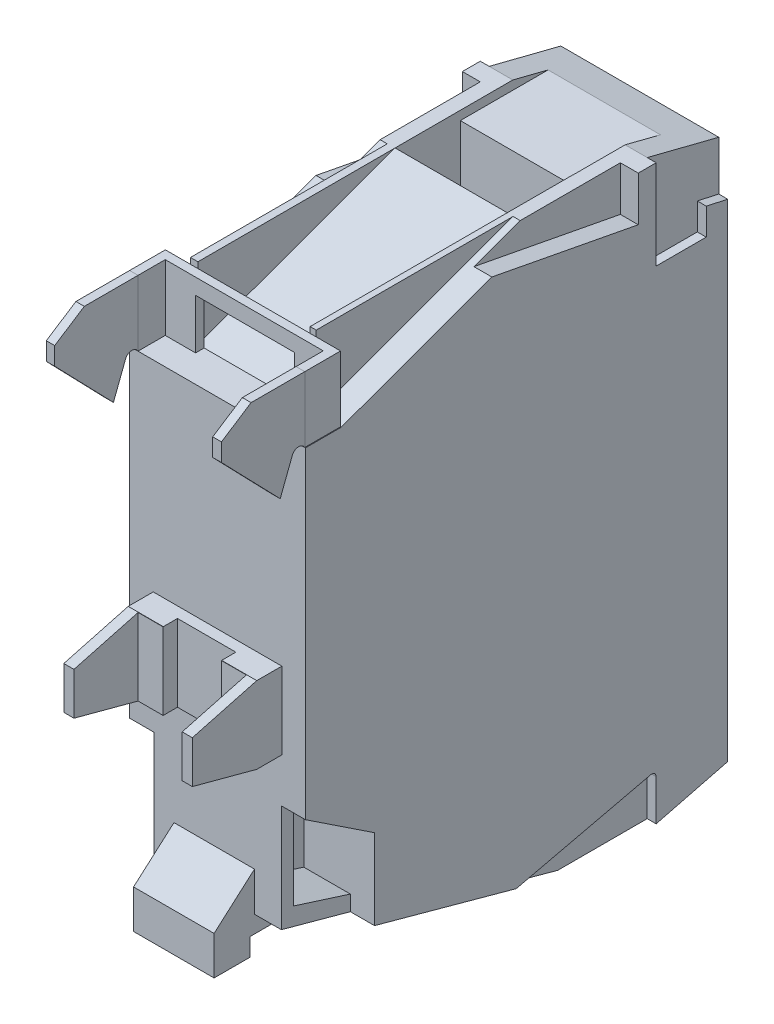
from build123d import *
from OCP.BRepFilletAPI import BRepFilletAPI_MakeChamfer

# Parameters (mm, degrees)
SKETCH1_W                = 9.83
SKETCH1_H                = 32
BOSS_EXTRUDE1_DEPTH      = 23.6
CUT_EXTRUDE1_REACH       = 32.159
CUT_EXTRUDE2_DEPTH       = 0.5
CUT_EXTRUDE3_DEPTH       = 0.5
CUT_EXTRUDE4_REACH       = 32.159
CUT_EXTRUDE5_DEPTH       = 0.5
CUT_EXTRUDE6_DEPTH       = 0.5
CUT_EXTRUDE7_REACH       = 32.159
SKETCH9_W                = 2
SKETCH9_H                = 4
CUT_EXTRUDE8_DEPTH       = 1
CUT_EXTRUDE9_DEPTH       = 1.4
CUT_EXTRUDE10_DEPTH      = 1
CUT_EXTRUDE11_DEPTH      = 1.4
CUT_EXTRUDE12_DEPTH      = 1.35
CUT_EXTRUDE13_DEPTH      = 1.35
CUT_EXTRUDE14_DEPTH      = 2.6
CUT_EXTRUDE15_DEPTH      = 3.6
SKETCH19_W               = 7.182897737
SKETCH19_H               = 2.178759377
CUT_EXTRUDE18_DEPTH      = 1.32
SKETCH21_W               = 8.285586635
SKETCH21_H               = 5.463762064
CUT_EXTRUDE19_DEPTH      = 4.25
BOSS_EXTRUDE2_DEPTH      = 2.25
BOSS_EXTRUDE2_DEPTH_BACK = 2.25
SKETCH23_W               = 6.27247625
SKETCH23_H               = 14.666987047
CUT_EXTRUDE20_DEPTH      = 4
BOSS_EXTRUDE3_REACH      = 33.466
SKETCH25_W               = 6.279577339
SKETCH25_H               = 6.156082968
CUT_EXTRUDE21_DEPTH      = 0.5
SKETCH26_W               = 7.185798512
SKETCH26_H               = 4.295592105
CUT_EXTRUDE22_DEPTH      = 31.802589265
BOSS_EXTRUDE4_DEPTH      = 5
BOSS_EXTRUDE4_DEPTH_BACK = 19.5
SKETCH27_W               = 7.185798512
SKETCH27_H               = 4.295592105
CUT_EXTRUDE23_DEPTH      = 4.295592
CHAMFER3_SIZE            = 3.6
CHAMFER3_SIZE2           = 0.964617093
CHAMFER4_SIZE            = 3.6
CHAMFER4_SIZE2           = 0.964617093
SKETCH29_W               = 3.499012957
SKETCH29_H               = 4.183403899
BOSS_EXTRUDE5_DEPTH      = 0.25
SKETCH30_R               = 2.75
SKETCH30_W               = 8.613757753
SKETCH30_H               = 3.512782784
CUT_EXTRUDE24_DEPTH      = 4
SKETCH31_R               = 2.75
CUT_EXTRUDE25_DEPTH      = 1
SKETCH32_R               = 2.75
BOSS_EXTRUDE6_DEPTH      = 0.75
BOSS_EXTRUDE6_2_DEPTH    = 0.75
SKETCH33_W               = 0.622313759
SKETCH33_H               = 4.486215778
SKETCH33_W_2             = 2.91691535
SKETCH33_H_2             = 0.583263223
SKETCH33_H_3             = 0.583263224
SKETCH33_H_4             = 4.486215777
CUT_EXTRUDE26_DEPTH      = 0.75
SKETCH35_W               = 9.791059678
SKETCH35_H               = 3.669794899
BOSS_EXTRUDE8_DEPTH      = 2
BOSS_EXTRUDE9_DEPTH      = 9.79106
SKETCH38_W               = 8.832235424
SKETCH38_H               = 8.039772077
CUT_EXTRUDE32_DEPTH      = 3.669795
CUT_EXTRUDE33_START      = -1.795116
SKETCH41_W               = 8.832235424
SKETCH41_H               = 2.428139179
CUT_EXTRUDE33_DEPTH      = 1.795116
CUT_EXTRUDE34_START      = -22.077145
SKETCH42_W               = 5.516661754
SKETCH42_H               = 2.788600357
CUT_EXTRUDE34_DEPTH      = 28.6
CUT_EXTRUDE35_DEPTH      = 0.01


with BuildPart() as part:
    # Sketch1 → Boss-Extrude1 (new body)
    with BuildSketch(Plane.XY):
        Rectangle(SKETCH1_W, SKETCH1_H)
    extrude(amount=BOSS_EXTRUDE1_DEPTH)

    # Sketch2 → Cut-Extrude1 (cut, up to next)
    with BuildSketch(Plane(origin=(4.915, 0, 0), x_dir=(0, 0, -1), z_dir=(1, 0, 0)), mode=Mode.PRIVATE) as cut_extrude1_sk1:
        Polygon((-4, 16), (0, 14.985828567), (0, 16), align=None)
    cut_extrude1_tool1 = extrude(cut_extrude1_sk1.sketch, amount=-CUT_EXTRUDE1_REACH, mode=Mode.PRIVATE) & part.part
    # Sketch2 → Cut-Extrude1 (cut, up to next)
    with BuildSketch(Plane(origin=(4.915, 0, 0), x_dir=(0, 0, -1), z_dir=(1, 0, 0)), mode=Mode.PRIVATE) as cut_extrude1_sk2:
        Polygon((0, -16), (0, -14.985828567), (-4, -16), align=None)
    cut_extrude1_tool2 = extrude(cut_extrude1_sk2.sketch, amount=-CUT_EXTRUDE1_REACH, mode=Mode.PRIVATE) & part.part
    add(cut_extrude1_tool1.solids().sort_by_distance((4.915, 15.661943, 1.333333))[0], mode=Mode.SUBTRACT)
    add(cut_extrude1_tool2.solids().sort_by_distance((4.915, -15.661943, 1.333333))[0], mode=Mode.SUBTRACT)

    # Sketch5 → Cut-Extrude2 (cut)
    with BuildSketch(Plane.ZY.offset(4.915)):
        Polygon((4, 16), (4, 11), (1.2, 11), (1.2, 12.5), (0, 12.235925398), (0, 14.985828567), align=None)
    extrude(amount=-CUT_EXTRUDE2_DEPTH, mode=Mode.SUBTRACT)

    # Sketch3 → Cut-Extrude3 (cut)
    with BuildSketch(Plane(origin=(4.915, 0, 0), x_dir=(0, 0, -1), z_dir=(1, 0, 0))):
        Polygon((-4, 16), (-4, 11), (-1.2, 11), (-1.2, 12.5), (0, 12.235925398), (0, 14.985828567), align=None)
    extrude(amount=-CUT_EXTRUDE3_DEPTH, mode=Mode.SUBTRACT)

    # Sketch6 → Cut-Extrude4 (cut, up to next)
    with BuildSketch(Plane(origin=(4.915, 0, 0), x_dir=(0, 0, -1), z_dir=(1, 0, 0)), mode=Mode.PRIVATE) as cut_extrude4_sk1:
        Polygon((-23.6, -12), (-9, -16), (-23.6, -16), align=None)
    cut_extrude4_tool1 = extrude(cut_extrude4_sk1.sketch, amount=-CUT_EXTRUDE4_REACH, mode=Mode.PRIVATE) & part.part
    add(cut_extrude4_tool1.solids().sort_by_distance((4.915, -14.666667, 18.733333))[0], mode=Mode.SUBTRACT)

    # Sketch7 → Cut-Extrude5 (cut)
    with BuildSketch(Plane(origin=(4.915, 0, 0), x_dir=(0, 0, -1), z_dir=(1, 0, 0))):
        with BuildLine():
            Line((-4, -16), (-4, -13.715163243))
            ThreePointArc((-4, -13.715163243), (-4.09463494, -13.519301818), (-4.306893584, -13.471723066))
            Line((-4.306893584, -13.471723066), (-11.819628513, -15.227499038))
            Line((-11.819628513, -15.227499038), (-9, -16))
            Line((-9, -16), (-4, -16))
        make_face()
    extrude(amount=-CUT_EXTRUDE5_DEPTH, mode=Mode.SUBTRACT)

    # Sketch8 → Cut-Extrude6 (cut)
    with BuildSketch(Plane.ZY.offset(4.915)):
        Polygon((4, -16), (4, -13.715163243), (4.09463494, -13.519301818), (4.306893584, -13.471723066), (11.819628513, -15.227499038), (9, -16), align=None)
    extrude(amount=-CUT_EXTRUDE6_DEPTH, mode=Mode.SUBTRACT)

    # Sketch9 → Cut-Extrude7 (cut, up to next)
    with BuildSketch(Plane(origin=(4.915, 0, 0), x_dir=(0, 0, -1), z_dir=(1, 0, 0)), mode=Mode.PRIVATE) as cut_extrude7_sk1:
        with Locations((-22.6, 14)):
            Rectangle(SKETCH9_W, SKETCH9_H)
    cut_extrude7_tool1 = extrude(cut_extrude7_sk1.sketch, amount=-CUT_EXTRUDE7_REACH, mode=Mode.PRIVATE) & part.part
    add(cut_extrude7_tool1.solids().sort_by_distance((4.915, 14, 22.6))[0], mode=Mode.SUBTRACT)

    # Sketch10 → Cut-Extrude8 (cut)
    with BuildSketch(Plane(origin=(4.915, 0, 0), x_dir=(0, 0, -1), z_dir=(1, 0, 0))):
        Polygon((-5, 13.5), (-5, 16), (-18.10239553, 16), align=None)
    extrude(amount=-CUT_EXTRUDE8_DEPTH, mode=Mode.SUBTRACT)

    # Sketch11 → Cut-Extrude9 (cut)
    with BuildSketch(Plane(origin=(4.915, 0, 0), x_dir=(0, 0, -1), z_dir=(1, 0, 0))):
        Polygon((-21.6, 16), (-10.6, 16), (-21.6, 12), align=None)
    extrude(amount=-CUT_EXTRUDE9_DEPTH, mode=Mode.SUBTRACT)

    # Sketch12 → Cut-Extrude10 (cut)
    with BuildSketch(Plane.ZY.offset(4.915)):
        Polygon((5, 16), (5, 13.5), (18.10239553, 16), align=None)
    extrude(amount=-CUT_EXTRUDE10_DEPTH, mode=Mode.SUBTRACT)

    # Sketch13 → Cut-Extrude11 (cut)
    with BuildSketch(Plane.ZY.offset(4.915)):
        Polygon((21.6, 12), (21.6, 16), (10.6, 16), align=None)
    extrude(amount=-CUT_EXTRUDE11_DEPTH, mode=Mode.SUBTRACT)

    # Sketch14 → Cut-Extrude12 (cut)
    with BuildSketch(Plane(origin=(4.915, 0, 0), x_dir=(0, 0, -1), z_dir=(1, 0, 0))):
        Polygon((-23.6, -12), (-23.6, -6), (-19.742166853, -8.556940588), (-19.742166853, -13.056940588), align=None)
    extrude(amount=-CUT_EXTRUDE12_DEPTH, mode=Mode.SUBTRACT)

    # Sketch15 → Cut-Extrude13 (cut)
    with BuildSketch(Plane.ZY.offset(4.915)):
        Polygon((19.742166853, -13.056940588), (19.742166853, -8.556940588), (23.6, -6), (23.6, -12), align=None)
    extrude(amount=-CUT_EXTRUDE13_DEPTH, mode=Mode.SUBTRACT)

    # Sketch16 → Cut-Extrude14 (cut)
    with BuildSketch(Plane(origin=(3.565, 0, 0), x_dir=(0, 0, -1), z_dir=(1, 0, 0))):
        Polygon((-22.922592203, -6.448980406), (-22.922592203, -11.190433252), (-19.742166853, -12.201066505), (-19.742166853, -8.556940588), align=None)
    extrude(amount=-CUT_EXTRUDE14_DEPTH, mode=Mode.SUBTRACT)

    # Sketch18 → Cut-Extrude15 (cut)
    with BuildSketch(Plane.ZY.offset(3.565)):
        Polygon((19.742166853, -12.201066505), (19.742166853, -8.556940588), (22.922592203, -6.448980406), (22.922592203, -11.190433252), align=None)
    extrude(amount=-CUT_EXTRUDE15_DEPTH, mode=Mode.SUBTRACT)

    # Sketch19 → Cut-Extrude18 (cut)
    with BuildSketch(Plane(origin=(0, -14.080667223, -3.570052614), x_dir=(1, 0, 0), z_dir=(0, -0.9693290698641888, -0.2457664629607274))):
        with Locations((0.133177719, 6.014201082)):
            Rectangle(SKETCH19_W, SKETCH19_H)
    extrude(amount=-CUT_EXTRUDE18_DEPTH, mode=Mode.SUBTRACT)

    # Chamfer2
    # the kernel refuses this chamfer: 2.799038106, 0.75 mm, written as the material it takes off along each edge
    with BuildSketch(Plane(origin=(-3.45827115, -15.826489143, 3.315654727), x_dir=(-0.9905000388259536, -0.13329481236589955, -0.033795947717498075), z_dir=(0, 0.24576646296072743, -0.9693290698641889))) as chamfer2_piece_1_section:
        with BuildLine():
            Line((0.78644901, 0), (-0.42847656, 2.875581688))
            Line((-0.42847656, 2.875581688), (-0.483925507, 2.867883636))
            ThreePointArc((-0.483925507, 2.867883636), (-0.255335983, 1.432085195), (-0.055448947, -0.007698052))
            Line((-0.055448947, -0.007698052), (0.007698052, -0.055448947))
            ThreePointArc((0.007698052, -0.055448947), (0.39348681, -0.001889377), (0.794147061, -0.055448947))
            Line((0.794147061, -0.055448947), (0.78644901, 0))
        make_face()
    chamfer2_piece_1 = extrude(amount=2.178759377, mode=Mode.PRIVATE)
    chamfer2_piece_1 = split(chamfer2_piece_1, bisect_by=Plane(origin=(-3.7390551, -14.279241778, 2.584099058), z_dir=(0, -0.9693290698641888, -0.2457664629607274)), keep=Keep.TOP, mode=Mode.PRIVATE)
    add(chamfer2_piece_1, mode=Mode.SUBTRACT)
    with BuildSketch(Plane(origin=(-3.45827115, -15.291023158, 1.203719926), x_dir=(0, 0.11013687873881672, -0.9939164290531027), z_dir=(1, 0, 0))) as chamfer2_piece_2_section:
        with BuildLine():
            Line((0.78644901, 0), (-0.42847656, 2.875581688))
            Line((-0.42847656, 2.875581688), (-0.483925507, 2.867883636))
            ThreePointArc((-0.483925507, 2.867883636), (-0.255335983, 1.432085195), (-0.055448947, -0.007698052))
            Line((-0.055448947, -0.007698052), (0.007698052, -0.055448947))
            ThreePointArc((0.007698052, -0.055448947), (0.39348681, -0.001889377), (0.794147061, -0.055448947))
            Line((0.794147061, -0.055448947), (0.78644901, 0))
        make_face()
    chamfer2_piece_2 = extrude(amount=7.182897736, mode=Mode.PRIVATE)
    chamfer2_piece_2 = split(chamfer2_piece_2, bisect_by=Plane(origin=(0.133177718, -13.942501507, 1.255959612), z_dir=(0, -0.9693290698641888, -0.2457664629607274)), keep=Keep.TOP, mode=Mode.PRIVATE)
    add(chamfer2_piece_2, mode=Mode.SUBTRACT)
    with BuildSketch(Plane(origin=(3.724626587, -15.291023158, 1.203719926), x_dir=(0.9905000388259536, -0.1332948123658999, -0.03379594771749775), z_dir=(0, -0.24576646296072743, 0.9693290698641889))) as chamfer2_piece_3_section:
        with BuildLine():
            Line((0.78644901, 0), (-0.42847656, 2.875581688))
            Line((-0.42847656, 2.875581688), (-0.483925507, 2.867883636))
            ThreePointArc((-0.483925507, 2.867883636), (-0.255335983, 1.432085195), (-0.055448947, -0.007698052))
            Line((-0.055448947, -0.007698052), (0.007698052, -0.055448947))
            ThreePointArc((0.007698052, -0.055448947), (0.39348681, -0.001889377), (0.794147061, -0.055448947))
            Line((0.794147061, -0.055448947), (0.78644901, 0))
        make_face()
    chamfer2_piece_3 = extrude(amount=2.178759377, mode=Mode.PRIVATE)
    chamfer2_piece_3 = split(chamfer2_piece_3, bisect_by=Plane(origin=(4.005410537, -14.279241778, 2.584099058), z_dir=(0, -0.9693290698641888, -0.2457664629607274)), keep=Keep.TOP, mode=Mode.PRIVATE)
    add(chamfer2_piece_3, mode=Mode.SUBTRACT)
    with BuildSketch(Plane(origin=(-10.726593775, -15.291023158, 1.203719926), x_dir=(0, 0.11013687873882122, -0.9939164290531021), z_dir=(1, 0, 0))) as chamfer2_piece_4a_section:
        with BuildLine():
            Line((0.78644901, 0), (-0.42847656, 2.875581688))
            Line((-0.42847656, 2.875581688), (-0.483925507, 2.867883636))
            ThreePointArc((-0.483925507, 2.867883636), (-0.255335983, 1.432085195), (-0.055448947, -0.007698052))
            Line((-0.055448947, -0.007698052), (0.007698052, -0.055448947))
            ThreePointArc((0.007698052, -0.055448947), (0.39348681, -0.001889377), (0.794147061, -0.055448947))
            Line((0.794147061, -0.055448947), (0.78644901, 0))
        make_face()
    chamfer2_piece_4a = extrude(amount=14.451220361, mode=Mode.PRIVATE)
    chamfer2_piece_4a = split(chamfer2_piece_4a, bisect_by=Plane(origin=(-3.45827115, -14.683152158, 1.068172929), z_dir=(-1, 0, 0)), keep=Keep.TOP, mode=Mode.PRIVATE)
    chamfer2_piece_4a = split(chamfer2_piece_4a, bisect_by=Plane(origin=(-7.092432462, -13.942501507, 1.255959612), z_dir=(0, -0.9693290698641888, -0.2457664629607274)), keep=Keep.TOP, mode=Mode.PRIVATE)
    with BuildSketch(Plane(origin=(-3.45827115, -15.826489143, 3.315654727), x_dir=(-0.9905000388259536, -0.13329481236589955, -0.033795947717498075), z_dir=(0, 0.24576646296072743, -0.9693290698641889))) as chamfer2_piece_4b_section:
        with BuildLine():
            Line((0.78644901, 0), (-0.42847656, 2.875581688))
            Line((-0.42847656, 2.875581688), (-0.483925507, 2.867883636))
            ThreePointArc((-0.483925507, 2.867883636), (-0.255335983, 1.432085195), (-0.055448947, -0.007698052))
            Line((-0.055448947, -0.007698052), (0.007698052, -0.055448947))
            ThreePointArc((0.007698052, -0.055448947), (0.39348681, -0.001889377), (0.794147061, -0.055448947))
            Line((0.794147061, -0.055448947), (0.78644901, 0))
        make_face()
    chamfer2_piece_4b = extrude(amount=9.447082002, mode=Mode.PRIVATE)
    chamfer2_piece_4b = split(chamfer2_piece_4b, bisect_by=Plane(origin=(-3.7390551, -14.752159437, 1.340344974), z_dir=(0, 0.24576646296072743, -0.9693290698641889)), keep=Keep.TOP, mode=Mode.PRIVATE)
    chamfer2_piece_4b = split(chamfer2_piece_4b, bisect_by=Plane(origin=(-3.7390551, -13.118353814, -1.994566548), z_dir=(0, -0.9693290698641888, -0.2457664629607274)), keep=Keep.TOP, mode=Mode.PRIVATE)
    chamfer2_piece_4 = chamfer2_piece_4a & chamfer2_piece_4b
    add(chamfer2_piece_4, mode=Mode.SUBTRACT)
    with BuildSketch(Plane(origin=(3.724626587, -13.504713214, -5.841676483), x_dir=(0.9905000388259537, -0.13329481236589816, -0.0337959477174973), z_dir=(0, -0.24576646296072743, 0.9693290698641889))) as chamfer2_piece_5a_section:
        with BuildLine():
            Line((0.78644901, 0), (-0.42847656, 2.875581688))
            Line((-0.42847656, 2.875581688), (-0.483925507, 2.867883636))
            ThreePointArc((-0.483925507, 2.867883636), (-0.255335983, 1.432085195), (-0.055448947, -0.007698052))
            Line((-0.055448947, -0.007698052), (0.007698052, -0.055448947))
            ThreePointArc((0.007698052, -0.055448947), (0.39348681, -0.001889377), (0.794147061, -0.055448947))
            Line((0.794147061, -0.055448947), (0.78644901, 0))
        make_face()
    chamfer2_piece_5a = extrude(amount=9.447082002, mode=Mode.PRIVATE)
    chamfer2_piece_5a = split(chamfer2_piece_5a, bisect_by=Plane(origin=(4.005410537, -14.752159437, 1.340344974), z_dir=(0, 0.24576646296072743, -0.9693290698641889)), keep=Keep.TOP, mode=Mode.PRIVATE)
    chamfer2_piece_5a = split(chamfer2_piece_5a, bisect_by=Plane(origin=(4.005410537, -13.118353814, -1.994566548), z_dir=(0, -0.9693290698641888, -0.2457664629607274)), keep=Keep.TOP, mode=Mode.PRIVATE)
    with BuildSketch(Plane(origin=(-3.45827115, -15.291023158, 1.203719926), x_dir=(0, 0.11013687873881672, -0.9939164290531027), z_dir=(1, 0, 0))) as chamfer2_piece_5b_section:
        with BuildLine():
            Line((0.78644901, 0), (-0.42847656, 2.875581688))
            Line((-0.42847656, 2.875581688), (-0.483925507, 2.867883636))
            ThreePointArc((-0.483925507, 2.867883636), (-0.255335983, 1.432085195), (-0.055448947, -0.007698052))
            Line((-0.055448947, -0.007698052), (0.007698052, -0.055448947))
            ThreePointArc((0.007698052, -0.055448947), (0.39348681, -0.001889377), (0.794147061, -0.055448947))
            Line((0.794147061, -0.055448947), (0.78644901, 0))
        make_face()
    chamfer2_piece_5b = extrude(amount=14.451220361, mode=Mode.PRIVATE)
    chamfer2_piece_5b = split(chamfer2_piece_5b, bisect_by=Plane(origin=(3.724626587, -14.683152158, 1.068172929), z_dir=(1, 0, 0)), keep=Keep.TOP, mode=Mode.PRIVATE)
    chamfer2_piece_5b = split(chamfer2_piece_5b, bisect_by=Plane(origin=(7.358787899, -13.942501507, 1.255959612), z_dir=(0, -0.9693290698641888, -0.2457664629607274)), keep=Keep.TOP, mode=Mode.PRIVATE)
    chamfer2_piece_5 = chamfer2_piece_5a & chamfer2_piece_5b
    add(chamfer2_piece_5, mode=Mode.SUBTRACT)

    # Sketch21 → Cut-Extrude19 (cut)
    with BuildSketch(Plane(origin=(0, -14.080667223, -3.570052614), x_dir=(-1, 0, 0), z_dir=(0, -0.9693290698641888, -0.2457664629607274))):
        with Locations((0.065477832, -9.835461802)):
            Rectangle(SKETCH21_W, SKETCH21_H)
    extrude(amount=-CUT_EXTRUDE19_DEPTH, mode=Mode.SUBTRACT)

    # Sketch22 → Boss-Extrude2 (add, two sides: drawn at the far end of the back side and taken through both)
    with BuildSketch(Plane(origin=(-0.185, 0, 0), x_dir=(0, 0, -1), z_dir=(1, 0, 0)).offset(-BOSS_EXTRUDE2_DEPTH_BACK)):
        Polygon((-19.858118269, -12.957237014), (-23.858118269, -12.957237014), (-23.858118269, -13.957237014), (-25.858118269, -13.957237014), (-25.858118269, -11.798752032), (-23.592707946, -9.808092274), (-23.473074349, -11.374374647), align=None)
    extrude(amount=BOSS_EXTRUDE2_DEPTH + BOSS_EXTRUDE2_DEPTH_BACK)

    # Sketch23 → Cut-Extrude20 (cut)
    with BuildSketch(Plane(origin=(0, 16, 0), x_dir=(1, 0, 0), z_dir=(0, 1, 0))):
        with Locations((0.038081978, -14.266506477)):
            Rectangle(SKETCH23_W, SKETCH23_H)
    extrude(amount=-CUT_EXTRUDE20_DEPTH, mode=Mode.SUBTRACT)

    # Sketch24 → Boss-Extrude3 (add, up to next)
    with BuildSketch(Plane.ZY.offset(-3.174320103), mode=Mode.PRIVATE) as boss_extrude3_sk1:
        Polygon((10.579716493, 16), (21.6, 12), (10.579716493, 12), align=None)
    boss_extrude3_tool1 = extrude(boss_extrude3_sk1.sketch, amount=BOSS_EXTRUDE3_REACH, mode=Mode.PRIVATE) - part.part
    add(boss_extrude3_tool1.solids().sort_by_distance((3.17432, 13.333333, 14.253144))[0])

    # Sketch25 → Cut-Extrude21 (cut)
    with BuildSketch(Plane(origin=(0, 16, 0), x_dir=(1, 0, 0), z_dir=(0, 1, 0))):
        with Locations((0.041632523, -3.854971469)):
            Rectangle(SKETCH25_W, SKETCH25_H)
    extrude(amount=-CUT_EXTRUDE21_DEPTH, mode=Mode.SUBTRACT)

    # Sketch26 → Cut-Extrude22 (cut, through all)
    with BuildSketch(Plane(origin=(0, 0, 0), x_dir=(-1, 0, 0), z_dir=(0, 0, -1))):
        with Locations((0, -1.374951584)):
            Rectangle(SKETCH26_W, SKETCH26_H)
    extrude(amount=-CUT_EXTRUDE22_DEPTH, mode=Mode.SUBTRACT)



with BuildPart() as body_2:
    # Sketch27 → Boss-Extrude4 (new, two sides: drawn at the far end of the back side and taken through both)
    with BuildSketch(Plane.XY.offset(23.6).offset(-BOSS_EXTRUDE4_DEPTH_BACK)):
        with Locations((0, -1.374951584)):
            Rectangle(SKETCH27_W, SKETCH27_H)
    extrude(amount=BOSS_EXTRUDE4_DEPTH + BOSS_EXTRUDE4_DEPTH_BACK)

    # Sketch28 → Cut-Extrude23 (cut)
    with BuildSketch(Plane(origin=(0, 0.772844468, 0), x_dir=(1, 0, 0), z_dir=(0, 1, 0))):
        Polygon((-3.024869573, -28.6), (0, -28.6), (0, -24.208534676), (-1.631367449, -24.208534676), (-1.631367449, -25.013795774), (-3.024869573, -25.013795774), align=None)
        Polygon((0, -28.6), (3.024869573, -28.6), (3.024869573, -25.013795774), (1.631367449, -25.013795774), (1.631367449, -24.208534676), (0, -24.208534676), align=None)
    extrude(amount=-CUT_EXTRUDE23_DEPTH, mode=Mode.SUBTRACT)

    # Chamfer3: one chamfer whose edges measure the first distance from different faces: ONE call of the kernel's chamfer builder (chamfer() names one face for all edges)
    chamfer3_edges_1 = [body_2.edges().sort_by_distance(p)[0] for p in [
        (3.308884414, 0.772844468, 28.6),
    ]]
    chamfer3_side_1 = [body_2.faces().sort_by_distance(p)[0] for p in [
        (0, 0.772844468, 14.711727186),
    ]]
    chamfer3_edges_2 = [body_2.edges().sort_by_distance(p)[0] for p in [
        (3.308884414, -3.522747637, 28.6),
    ]]
    chamfer3_side_2 = [body_2.faces().sort_by_distance(p)[0] for p in [
        (0, -3.522747637, 14.711727186),
    ]]
    chamfer3 = BRepFilletAPI_MakeChamfer(body_2.part.solid().wrapped)
    for e in chamfer3_edges_1:
        chamfer3.Add(CHAMFER3_SIZE, CHAMFER3_SIZE2, e.wrapped, chamfer3_side_1[0].wrapped)  # the first distance lies on this face
    for e in chamfer3_edges_2:
        chamfer3.Add(CHAMFER3_SIZE, CHAMFER3_SIZE2, e.wrapped, chamfer3_side_2[0].wrapped)  # the first distance lies on this face
    add(Compound.cast(chamfer3.Shape()), mode=Mode.REPLACE)

    # Chamfer4: one chamfer whose edges measure the first distance from different faces: ONE call of the kernel's chamfer builder (chamfer() names one face for all edges)
    chamfer4_edges_1 = [body_2.edges().sort_by_distance(p)[0] for p in [
        (-3.308884414, 0.772844468, 28.6),
    ]]
    chamfer4_side_1 = [body_2.faces().sort_by_distance(p)[0] for p in [
        (-0.045509092, 0.772844468, 14.545239935),
    ]]
    chamfer4_edges_2 = [body_2.edges().sort_by_distance(p)[0] for p in [
        (-3.308884414, -3.522747637, 28.6),
    ]]
    chamfer4_side_2 = [body_2.faces().sort_by_distance(p)[0] for p in [
        (-0.045509092, -3.522747637, 14.545239935),
    ]]
    chamfer4 = BRepFilletAPI_MakeChamfer(body_2.part.solid().wrapped)
    for e in chamfer4_edges_1:
        chamfer4.Add(CHAMFER4_SIZE, CHAMFER4_SIZE2, e.wrapped, chamfer4_side_1[0].wrapped)  # the first distance lies on this face
    for e in chamfer4_edges_2:
        chamfer4.Add(CHAMFER4_SIZE, CHAMFER4_SIZE2, e.wrapped, chamfer4_side_2[0].wrapped)  # the first distance lies on this face
    add(Compound.cast(chamfer4.Shape()), mode=Mode.REPLACE)


with BuildPart() as part_1:
    add(part.part)

    add(body_2.part)  # Boss-Extrude5 merges body 2
    # Sketch29 → Boss-Extrude5 (add)
    with BuildSketch(Plane(origin=(0, 0, 4.1), x_dir=(-1, 0, 0), z_dir=(0, 0, -1))):
        with Locations((-0.007925079, -1.431045688)):
            Rectangle(SKETCH29_W, SKETCH29_H)
    extrude(amount=BOSS_EXTRUDE5_DEPTH)

    # Sketch30 → Cut-Extrude24 (cut)
    with BuildSketch(Plane(origin=(0, 0, 0), x_dir=(-1, 0, 0), z_dir=(0, 0, -1))):
        with Locations((0, 9.681432772)):
            Circle(SKETCH30_R)
        with Locations((0, -10.236294495)):
            Circle(SKETCH30_R)
        with Locations((-0.080372339, 9.625466097)):
            Rectangle(SKETCH30_W, SKETCH30_H)
    extrude(amount=-CUT_EXTRUDE24_DEPTH, mode=Mode.SUBTRACT)

    # Sketch31 → Cut-Extrude25 (cut)
    with BuildSketch(Plane(origin=(0, 0, 4), x_dir=(-1, 0, 0), z_dir=(0, 0, -1))):
        with Locations((0, 9.681432772)):
            Circle(SKETCH31_R)
        with Locations((0, -10.236294495)):
            Circle(SKETCH31_R)
    extrude(amount=-CUT_EXTRUDE25_DEPTH, mode=Mode.SUBTRACT)

    # Sketch43 → Cut-Extrude35 (cut)
    with BuildSketch(Plane(origin=(0, 0, 0), x_dir=(-1, 0, 0), z_dir=(0, 0, -1))):
        Polygon((-0.670793992, 1.057778526), (-0.670793992, 3.153774619), (-0.63678444, 3.153774619), (0.377204055, 1.59059484), (0.377204055, 3.153774619), (0.538434524, 3.153774619), (0.538434524, 1.057778526), (0.501905746, 1.057778526), (-0.509563523, 2.617179466), (-0.509563523, 1.057778526), align=None)
        with BuildLine():
            Line((2.207169876, 2.769172772), (2.085407282, 2.643211468))
            add(Edge.make_bspline(
                [(2.085407282, 2.643211468), (2.068745196, 2.670451516), (2.036380064, 2.723363724), (1.979938123, 2.794599751), (1.917669166, 2.85465587), (1.851067126, 2.904671417), (1.780261302, 2.944198517), (1.705368563, 2.972055623), (1.627158711, 2.989588583), (1.573675889, 2.991553531), (1.546712773, 2.992544151)],
                knots=[0, 0, 0, 0, 1.135693638, 2.206018759, 3.223992528, 4.206184903, 5.162592443, 6.098801558, 7.041519676, 8, 8, 8, 8], degree=3))
            add(Edge.make_bspline(
                [(1.546712773, 2.992544151), (1.531855172, 2.992295616), (1.50216045, 2.991798888), (1.458246659, 2.985491277), (1.415074397, 2.976418037), (1.372822275, 2.963204669), (1.331434066, 2.946431794), (1.290608984, 2.926117617), (1.251012698, 2.901740946), (1.212273186, 2.873972286), (1.175188019, 2.843003124), (1.139787623, 2.809514454), (1.10704704, 2.773000244), (1.075823198, 2.73458757), (1.047334211, 2.693158293), (1.020682533, 2.649357421), (0.996593668, 2.602793502), (0.974197762, 2.554128674), (0.954617245, 2.503313261), (0.937290653, 2.45096023), (0.923166021, 2.396744851), (0.910862878, 2.341206434), (0.901609987, 2.28400788), (0.895598879, 2.225252641), (0.891017563, 2.165049839), (0.890643257, 2.124259993), (0.890454381, 2.103677217)],
                knots=[0, 0, 0, 0, 0.872413377, 1.743624148, 2.601810317, 3.462868589, 4.341039258, 5.223781062, 6.13921199, 7.070430216, 8.022373848, 8.976411344, 9.931299268, 10.902343116, 11.883366553, 12.883408275, 13.913437901, 14.962338874, 16.029936028, 17.111882572, 18.201119231, 19.320673536, 20.453740451, 21.603577775, 22.790752465, 24, 24, 24, 24], degree=3))
            add(Edge.make_bspline(
                [(0.890454381, 2.103677217), (0.890987462, 2.072723444), (0.892031762, 2.012085399), (0.901145807, 1.923142401), (0.915441786, 1.838110374), (0.936853801, 1.757118428), (0.963009991, 1.679728492), (0.995468093, 1.606152223), (1.034257823, 1.536903048), (1.078030621, 1.471985285), (1.126446811, 1.412998933), (1.178364621, 1.361009544), (1.233919324, 1.317424796), (1.292085852, 1.281344777), (1.353564151, 1.253226597), (1.418279459, 1.233738496), (1.486018972, 1.220829678), (1.532376474, 1.21962274), (1.555949935, 1.219008994)],
                knots=[0, 0, 0, 0, 1.2059327, 2.362406674, 3.480524526, 4.562612735, 5.623337043, 6.661098003, 7.691437249, 8.712510888, 9.708320492, 10.66089415, 11.569762527, 12.453727026, 13.322622265, 14.195564816, 15.082418534, 16, 16, 16, 16], degree=3))
            add(Edge.make_bspline(
                [(1.555949935, 1.219008994), (1.581931784, 1.220025128), (1.633305601, 1.222034325), (1.708473241, 1.239110104), (1.780224445, 1.266591684), (1.848475301, 1.305528221), (1.913497993, 1.355131034), (1.974933532, 1.415876863), (2.033238803, 1.48733389), (2.06759491, 1.54068243), (2.085407282, 1.568341677)],
                knots=[0, 0, 0, 0, 0.93689583, 1.852520847, 2.767253495, 3.701530616, 4.678576124, 5.71099564, 6.813235843, 8, 8, 8, 8], degree=3))
            Line((2.085407282, 1.568341677), (2.207169876, 1.443639986))
            add(Edge.make_bspline(
                [(2.207169876, 1.443639986), (2.197696866, 1.426597517), (2.178923552, 1.392823285), (2.147936798, 1.34472536), (2.115009813, 1.299800165), (2.08092637, 1.257270558), (2.044556138, 1.218166778), (2.006594816, 1.181815753), (1.96701362, 1.148424652), (1.925550874, 1.118372617), (1.882768236, 1.091313536), (1.838443479, 1.068219797), (1.792990652, 1.04842387), (1.746322976, 1.031930598), (1.698295187, 1.019276066), (1.648983661, 1.010646412), (1.598494971, 1.004856345), (1.564363701, 1.004310569), (1.547132644, 1.004035036)],
                knots=[0, 0, 0, 0, 1.120033088, 2.219646473, 3.284367226, 4.319154029, 5.349055599, 6.350017175, 7.337353397, 8.321672642, 9.289931778, 10.243047789, 11.190141157, 12.136175768, 13.084053903, 14.039879559, 15.01043975, 16, 16, 16, 16], degree=3))
            add(Edge.make_bspline(
                [(1.547132644, 1.004035036), (1.530884098, 1.004197108), (1.498598351, 1.004519145), (1.450964468, 1.009524173), (1.40449098, 1.01641047), (1.359556322, 1.02673027), (1.31560174, 1.039029029), (1.273299465, 1.055318687), (1.23200714, 1.073545091), (1.192310123, 1.095308041), (1.153676691, 1.119600168), (1.116255678, 1.146838716), (1.080623431, 1.177313275), (1.045993106, 1.210107898), (1.012810419, 1.24591339), (0.980903643, 1.284640419), (0.950129513, 1.3262222), (0.931161472, 1.355637902), (0.921524836, 1.37058243)],
                knots=[0, 0, 0, 0, 1.025194621, 2.037054553, 3.020434316, 3.989260086, 4.945557148, 5.898952184, 6.848039227, 7.792881249, 8.753738336, 9.727426248, 10.711599443, 11.711470044, 12.736702733, 13.790987993, 14.877720364, 16, 16, 16, 16], degree=3))
            add(Edge.make_bspline(
                [(0.921524836, 1.37058243), (0.906100705, 1.396795099), (0.875076868, 1.449518821), (0.836471919, 1.533478072), (0.802877986, 1.621017214), (0.776483761, 1.712881039), (0.75450225, 1.808359466), (0.740533735, 1.90812079), (0.730658647, 2.011667041), (0.729707898, 2.082098913), (0.729223912, 2.117952832)],
                knots=[0, 0, 0, 0, 0.93320784, 1.87703854, 2.833065133, 3.809300283, 4.808988226, 5.838375245, 6.899607296, 8, 8, 8, 8], degree=3))
            add(Edge.make_bspline(
                [(0.729223912, 2.117952832), (0.729947522, 2.155629741), (0.731368277, 2.229605587), (0.742602979, 2.338192098), (0.760289816, 2.442298468), (0.786232504, 2.541554646), (0.818276326, 2.636779185), (0.858843369, 2.726893652), (0.90603429, 2.812876702), (0.960241473, 2.893177946), (1.019569015, 2.966757135), (1.083560741, 3.031195825), (1.151723778, 3.085202675), (1.222921688, 3.130383518), (1.298319026, 3.165154105), (1.377556474, 3.189452691), (1.460339568, 3.20463653), (1.516836802, 3.206549282), (1.54545316, 3.207518109)],
                knots=[0, 0, 0, 0, 1.195271502, 2.34682787, 3.460228925, 4.542725944, 5.598821008, 6.644472296, 7.67408218, 8.707477688, 9.714544999, 10.669163693, 11.582576715, 12.468500816, 13.338827293, 14.208303603, 15.092489635, 16, 16, 16, 16], degree=3))
            add(Edge.make_bspline(
                [(1.54545316, 3.207518109), (1.562821163, 3.20722329), (1.597364843, 3.206636915), (1.648476977, 3.201090447), (1.698378378, 3.191691734), (1.746944041, 3.179170592), (1.794421192, 3.163308208), (1.840124358, 3.142876869), (1.884744605, 3.119339718), (1.928039628, 3.092507909), (1.969538565, 3.062124212), (2.009537767, 3.029067062), (2.047201982, 2.992677135), (2.083689636, 2.954106392), (2.117432397, 2.912022163), (2.149598518, 2.867218264), (2.179771326, 2.819558068), (2.197978979, 2.786074617), (2.207169876, 2.769172772)],
                knots=[0, 0, 0, 0, 0.996050703, 1.981071612, 2.944758098, 3.906703988, 4.856240635, 5.812440303, 6.774922097, 7.748490416, 8.731283955, 9.723249409, 10.722659482, 11.73373946, 12.766922331, 13.814078862, 14.896586223, 16, 16, 16, 16], degree=3))
        make_face()
        Polygon((3.269498979, 4.282743905), (3.85654325, 4.282743905), (3.85654325, 1.107743905), (3.571607352, 1.107743905), (3.571607352, 3.95710288), (3.083145814, 3.95710288), align=None)
        with BuildLine():
            Line((2.813292198, -5.429753852), (2.528356301, -5.429753852))
            add(Edge.make_bspline(
                [(2.528356301, -5.429753852), (2.530213361, -5.391952404), (2.533860578, -5.317711365), (2.550940526, -5.209467536), (2.57537975, -5.10600354), (2.60993414, -5.008150118), (2.652847692, -4.915042057), (2.704309932, -4.827049186), (2.765264353, -4.744507179), (2.834394748, -4.668181228), (2.909477727, -4.598161075), (2.990490972, -4.537695247), (3.075621819, -4.486607074), (3.164611988, -4.443897662), (3.258465499, -4.411839373), (3.356330663, -4.3880526), (3.458637451, -4.373741201), (3.528342328, -4.372202881), (3.563792999, -4.371420519)],
                knots=[0, 0, 0, 0, 1.10065271, 2.161652631, 3.183658789, 4.190468796, 5.17591951, 6.163126047, 7.15150782, 8.156236427, 9.156009102, 10.134482811, 11.092018607, 12.041330605, 13.001268258, 13.972401359, 14.968799086, 16, 16, 16, 16], degree=3))
            add(Edge.make_bspline(
                [(3.563792999, -4.371420519), (3.598607395, -4.372235547), (3.667016439, -4.373837048), (3.766858409, -4.387590268), (3.861906384, -4.409130912), (3.951974572, -4.439352754), (4.036344359, -4.479978627), (4.115649549, -4.52878068), (4.190834285, -4.585222956), (4.258513296, -4.651674629), (4.32065991, -4.722615364), (4.374274099, -4.798350819), (4.420187469, -4.8765731), (4.458457721, -4.957878683), (4.486630076, -5.043033116), (4.508018879, -5.130796649), (4.520108747, -5.222077728), (4.521964238, -5.283860104), (4.522907583, -5.315270679)],
                knots=[0, 0, 0, 0, 1.111607364, 2.184268762, 3.212621178, 4.221274766, 5.211760367, 6.196651075, 7.1921475, 8.207485113, 9.220403448, 10.201281604, 11.166441695, 12.114753415, 13.065576456, 14.026450734, 14.996634279, 16, 16, 16, 16], degree=3))
            add(Edge.make_bspline(
                [(4.522907583, -5.315270679), (4.521371551, -5.359491929), (4.518326444, -5.447158408), (4.492278402, -5.575986177), (4.45159621, -5.700803064), (4.402612893, -5.801257617), (4.353198605, -5.882205143), (4.308669223, -5.948851754), (4.25654043, -6.020611715), (4.196053507, -6.097244728), (4.128459687, -6.179351049), (4.053146725, -6.266881077), (3.969577566, -6.358930469), (3.910923069, -6.42180055), (3.880529778, -6.454378251)],
                knots=[0, 0, 0, 0, 1.184426356, 2.348067706, 3.509069118, 4.696110526, 5.333549288, 6.050745305, 6.844228056, 7.710549037, 8.667450064, 9.695053472, 10.805634456, 12, 12, 12, 12], degree=3))
            Line((3.880529778, -6.454378251), (3.08614376, -7.302189749))
            Line((3.08614376, -7.302189749), (4.563612711, -7.302189749))
            Line((4.563612711, -7.302189749), (4.563612711, -7.627830775))
            Line((4.563612711, -7.627830775), (2.406240916, -7.627830775))
            Line((2.406240916, -7.627830775), (3.637571044, -6.313818355))
            add(Edge.make_bspline(
                [(3.637571044, -6.313818355), (3.667550199, -6.282523463), (3.725134019, -6.222412379), (3.806579642, -6.134652694), (3.879730724, -6.053237039), (3.945060788, -5.978319242), (4.001152611, -5.908803462), (4.050929564, -5.846941124), (4.090812636, -5.790013873), (4.134097316, -5.724027744), (4.176019999, -5.643462285), (4.212044779, -5.545006724), (4.234011106, -5.443654145), (4.236646207, -5.375163011), (4.237971685, -5.340711384)],
                knots=[0, 0, 0, 0, 1.329631726, 2.553950428, 3.673215718, 4.687767853, 5.603093632, 6.413772471, 7.123043292, 7.734684054, 8.834405432, 9.900288307, 10.943827018, 12, 12, 12, 12], degree=3))
            add(Edge.make_bspline(
                [(4.237971685, -5.340711384), (4.237394976, -5.319047544), (4.236258393, -5.276352275), (4.226227482, -5.213754194), (4.211068666, -5.153370399), (4.189346896, -5.095015151), (4.160675067, -5.039275167), (4.125774216, -4.986082596), (4.085506087, -4.934657606), (4.038923149, -4.886439971), (3.987749842, -4.842279163), (3.933689344, -4.803159457), (3.876493893, -4.770466835), (3.816404639, -4.743666663), (3.753589106, -4.722643281), (3.687925801, -4.708075856), (3.619596158, -4.698929602), (3.57293863, -4.697692104), (3.549164594, -4.697061544)],
                knots=[0, 0, 0, 0, 0.991446411, 1.95395049, 2.89581595, 3.838931463, 4.798493298, 5.75982156, 6.748411868, 7.785213223, 8.824556874, 9.840280684, 10.836137867, 11.835679398, 12.848801643, 13.863922112, 14.911575587, 16, 16, 16, 16], degree=3))
            add(Edge.make_bspline(
                [(3.549164594, -4.697061544), (3.524335338, -4.697710181), (3.47557478, -4.698983995), (3.403983943, -4.707894555), (3.335688988, -4.723266853), (3.270518119, -4.744291408), (3.208361066, -4.77101452), (3.149520112, -4.804299174), (3.094127348, -4.844017057), (3.042078645, -4.889048133), (2.994123464, -4.939183743), (2.951989512, -4.995072781), (2.915174013, -5.055694793), (2.88305278, -5.120886207), (2.856967261, -5.191238564), (2.837034475, -5.266502125), (2.821262121, -5.346350093), (2.815992963, -5.401490848), (2.813292198, -5.429753852)],
                knots=[0, 0, 0, 0, 1.031018746, 2.02475058, 2.990194455, 3.934040569, 4.864654155, 5.795059489, 6.735614925, 7.690564532, 8.649604399, 9.611025574, 10.590972636, 11.591080095, 12.624614302, 13.701020113, 14.821632451, 16, 16, 16, 16], degree=3))
        make_face()
    extrude(amount=-CUT_EXTRUDE35_DEPTH, mode=Mode.SUBTRACT)


with BuildPart() as body_2_2:
    # Sketch32 → Boss-Extrude6 (new body)
    with BuildSketch(Plane(origin=(0, 0, 5), x_dir=(-1, 0, 0), z_dir=(0, 0, -1))):
        with Locations((0, 9.681432772)):
            Circle(SKETCH32_R)
    extrude(amount=BOSS_EXTRUDE6_DEPTH)


with BuildPart() as body_3:
    # Sketch32 → Boss-Extrude6 2 (new body)
    with BuildSketch(Plane(origin=(0, 0, 5), x_dir=(-1, 0, 0), z_dir=(0, 0, -1))):
        with Locations((0, -10.236294495)):
            Circle(SKETCH32_R)
    extrude(amount=BOSS_EXTRUDE6_2_DEPTH)


with BuildPart() as cut_extrude26_tool:
    # Sketch33 → Cut-Extrude26 (new body)
    with BuildSketch(Plane(origin=(0, 0, 4.25), x_dir=(-1, 0, 0), z_dir=(0, 0, -1))):
        with Locations((-0.012180533, 9.635108008)):
            Rectangle(SKETCH33_W, SKETCH33_H)
        with Locations((0, 9.681432773)):
            Rectangle(SKETCH33_W_2, SKETCH33_H_2)
        with Locations((0, -10.236294495)):
            Rectangle(SKETCH33_W_2, SKETCH33_H_3)
        with Locations((-0.012180533, -10.18996973)):
            Rectangle(SKETCH33_W, SKETCH33_H_4)
    extrude(amount=-CUT_EXTRUDE26_DEPTH)


with BuildPart() as body_2_2_1:
    add(body_2_2.part)

    # Cut-Extrude26: cut by cut_extrude26_tool
    add(cut_extrude26_tool.part, mode=Mode.SUBTRACT)


with BuildPart() as body_3_1:
    add(body_3.part)

    # Cut-Extrude26: cut by cut_extrude26_tool
    add(cut_extrude26_tool.part, mode=Mode.SUBTRACT)


with BuildPart() as body_4:
    # Sketch35 → Boss-Extrude8 (new body)
    with BuildSketch(Plane.XY.offset(21.6)):
        with Locations((-0.019470161, 13.83489745)):
            Rectangle(SKETCH35_W, SKETCH35_H)
    extrude(amount=BOSS_EXTRUDE8_DEPTH)


with BuildPart() as body_5:
    # Sketch37 → Boss-Extrude9 (new body)
    with BuildSketch(Plane.ZY.offset(4.915)):
        with BuildLine():
            Line((23.6, 15.669794899), (26.6, 15.669794899))
            Line((26.6, 15.669794899), (28.257106334, 14.598705198))
            Line((28.257106334, 14.598705198), (28.257106334, 13.598705198))
            Line((28.257106334, 13.598705198), (24.973777927, 10.204883845))
            Line((24.973777927, 10.204883845), (24.282154385, 12.000406968))
            ThreePointArc((24.282154385, 12.000406968), (23.940953368, 12.20775566), (23.6, 12))
            Line((23.6, 12), (23.6, 15.669794899))
        make_face()
    extrude(amount=-BOSS_EXTRUDE9_DEPTH)


with BuildPart() as cut_extrude32_tool:
    # Sketch38 → Cut-Extrude32 (new body)
    with BuildSketch(Plane(origin=(0, 15.669794899, 0), x_dir=(1, 0, 0), z_dir=(0, 1, 0))):
        with Locations((-0.02919907, -26.097031493)):
            Rectangle(SKETCH38_W, SKETCH38_H)
    extrude(amount=-CUT_EXTRUDE32_DEPTH)


with BuildPart() as body_4_1:
    add(body_4.part)

    # Cut-Extrude32: cut by cut_extrude32_tool
    add(cut_extrude32_tool.part, mode=Mode.SUBTRACT)

    # Sketch42 → Cut-Extrude34 (cut)
    with BuildSketch(Plane.XY.offset(22.077145454).offset(CUT_EXTRUDE34_START)):
        with Locations((0.007724321, 13.394300178)):
            Rectangle(SKETCH42_W, SKETCH42_H)
    extrude(amount=CUT_EXTRUDE34_DEPTH, mode=Mode.SUBTRACT)


with BuildPart() as body_5_1:
    add(body_5.part)

    # Cut-Extrude32: cut by cut_extrude32_tool
    add(cut_extrude32_tool.part, mode=Mode.SUBTRACT)

    # Sketch41 → Cut-Extrude33 (cut)
    with BuildSketch(Plane(origin=(0, 12, 0), x_dir=(1, 0, 0), z_dir=(0, 1, 0)).offset(CUT_EXTRUDE33_START)):
        with Locations((-0.02919907, -25.496380736)):
            Rectangle(SKETCH41_W, SKETCH41_H)
    extrude(amount=CUT_EXTRUDE33_DEPTH, mode=Mode.SUBTRACT)


with BuildPart() as cut_extrude33_piece_1:
    # of the separate pieces the step leaves, piece 1, a body of its own (cut_extrude33_pieces)
    add(body_5_1.part.solids().sort_by_distance((4.386918642, 15.669794899, 23.6))[0])


with BuildPart() as cut_extrude33_piece_2:
    # of the separate pieces the step leaves, piece 2, a body of its own (cut_extrude33_pieces)
    add(body_5_1.part.solids().sort_by_distance((-4.915, 15.669794899, 23.6))[0])


solid = Compound([part_1.part, body_2_2_1.part, body_3_1.part, body_4_1.part, cut_extrude33_piece_1.part, cut_extrude33_piece_2.part])
